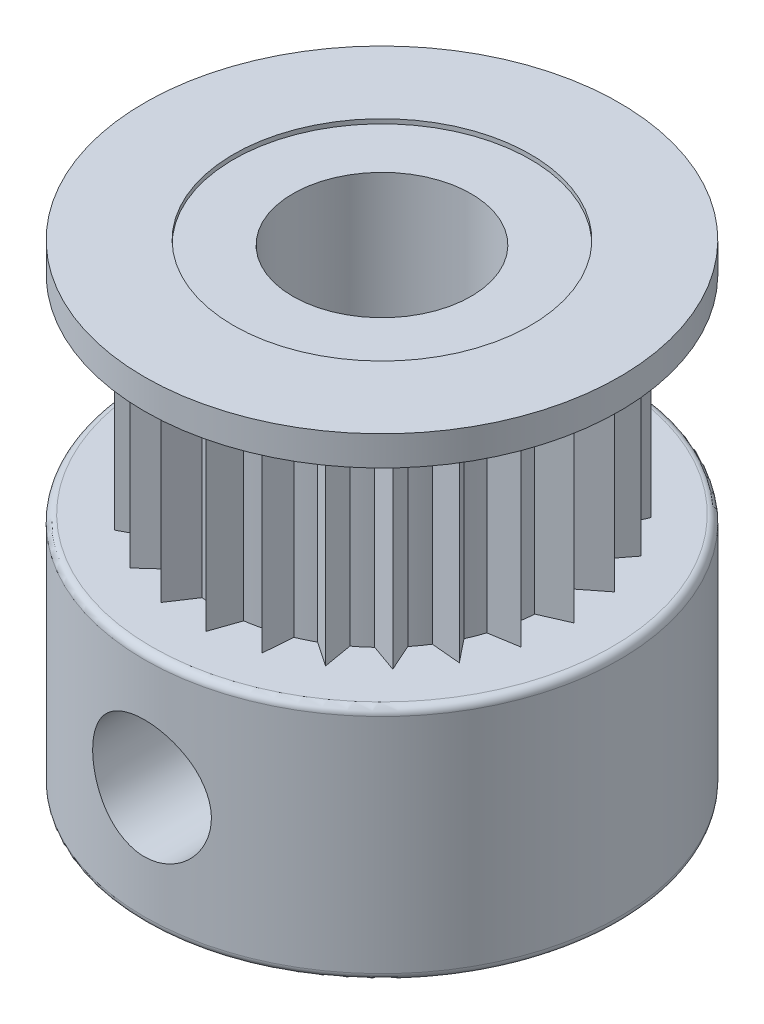
from build123d import *

# Parameters (mm, degrees)
SKETCH1_R           = 8
BOSS_EXTRUDE1_DEPTH = 16
SKETCH3_R           = 5
CUT_EXTRUDE2_DEPTH  = 0.15
CUT_EXTRUDE3_START  = -15.85
SKETCH3_2_R         = 5
CUT_EXTRUDE3_DEPTH  = 0.15
CUT_EXTRUDE6_START  = -8
SKETCH4_OUTSIDE_W   = 23.542
SKETCH4_OUTSIDE_H   = 23.542
SKETCH4_OUTSIDE_R   = 5.5
CUT_EXTRUDE6_DEPTH  = 7
BOSS_EXTRUDE2_START = -1
BOSS_EXTRUDE2_DEPTH = 8
SKETCH2_R           = 3
CUT_EXTRUDE1_DEPTH  = 20.595917942
FILLET1_R           = 0.25
CUT_EXTRUDE7_START  = 2.236067873
CUT_EXTRUDE7_DEPTH  = 6.763932127
CIRPATTERN1_COUNT   = 2
CIRPATTERN1_ANGLE   = 85


with BuildPart() as part:
    # Sketch1 → Boss-Extrude1 (new body)
    with BuildSketch(Plane(origin=(0, 0, 0), x_dir=(1, 0, 0), z_dir=(0, 1, 0))):
        with Locations(Location((0, 0, 0), (0, 0, 270))):
            Circle(SKETCH1_R)
    extrude(amount=BOSS_EXTRUDE1_DEPTH)

    # Sketch3 → Cut-Extrude2 (cut)
    with BuildSketch(Plane(origin=(0, 16, 0), x_dir=(1, 0, 0), z_dir=(0, 1, 0))):
        with Locations(Location((0, 0, 0), (0, 0, 270))):
            Circle(SKETCH3_R)
    extrude(amount=-CUT_EXTRUDE2_DEPTH, mode=Mode.SUBTRACT)

    # Sketch3<2> → Cut-Extrude3 (cut)
    with BuildSketch(Plane(origin=(0, 16, 0), x_dir=(1, 0, 0), z_dir=(0, 1, 0)).offset(CUT_EXTRUDE3_START)):
        with Locations(Location((0, 0, 0), (0, 0, 270))):
            Circle(SKETCH3_2_R)
    extrude(amount=-CUT_EXTRUDE3_DEPTH, mode=Mode.SUBTRACT)

    # Sketch4 outside → Cut-Extrude6 (cut)
    with BuildSketch(Plane(origin=(0, 16, 0), x_dir=(1, 0, 0), z_dir=(0, 1, 0)).offset(CUT_EXTRUDE6_START)):
        Rectangle(SKETCH4_OUTSIDE_W, SKETCH4_OUTSIDE_H)
        with Locations(Location((0, 0, 0), (0, 0, 270))):
            Circle(SKETCH4_OUTSIDE_R, mode=Mode.SUBTRACT)
    extrude(amount=CUT_EXTRUDE6_DEPTH, mode=Mode.SUBTRACT)

    # Sketch5 → Boss-Extrude2 (add)
    with BuildSketch(Plane(origin=(0, 8, 0), x_dir=(1, 0, 0), z_dir=(0, 1, 0)).offset(BOSS_EXTRUDE2_START)):
        with BuildLine():
            ThreePointArc((0.785673383, -5.443594156), (0.393847777, -5.485880415), (0, -5.5))
            Line((0, -5.5), (0.458657655, -6.388613052))
            Line((0.458657655, -6.388613052), (0.785673383, -5.443594156))
        make_face()
        with BuildLine():
            Line((-1.144535378, -6.301966545), (-0.592776807, -5.467962661))
            ThreePointArc((-0.592776807, -5.467962661), (-0.982808657, -5.411477353), (-1.367794379, -5.327207386))
            Line((-1.367794379, -5.327207386), (-1.144535378, -6.301966545))
        make_face()
        with BuildLine():
            ThreePointArc((2.114756826, -5.07718461), (1.745757306, -5.215585435), (1.367794379, -5.327207386))
            Line((1.367794379, -5.327207386), (2.03303154, -6.073839504))
            Line((2.03303154, -6.073839504), (2.114756826, -5.07718461))
        make_face()
        with BuildLine():
            Line((-2.675813043, -5.819344304), (-1.933980651, -5.148758961))
            ThreePointArc((-1.933980651, -5.148758961), (-2.297711608, -4.997051267), (-2.649645208, -4.81968674))
            Line((-2.649645208, -4.81968674), (-2.675813043, -5.819344304))
        make_face()
        with BuildLine():
            ThreePointArc((3.310962319, -4.391756883), (2.987974483, -4.61757604), (2.649645208, -4.81968674))
            Line((2.649645208, -4.81968674), (3.479662577, -5.377424283))
            Line((3.479662577, -5.377424283), (3.310962319, -4.391756883))
        make_face()
        with BuildLine():
            Line((-4.038959534, -4.971071258), (-3.153665377, -4.506039801))
            ThreePointArc((-3.153665377, -4.506039801), (-3.468240889, -4.268642072), (-3.765009083, -4.009327451))
            Line((-3.765009083, -4.009327451), (-4.038959534, -4.971071258))
        make_face()
        with BuildLine():
            ThreePointArc((4.299127873, -3.430378919), (4.042446235, -3.729427361), (3.765009083, -4.009327451))
            Line((3.765009083, -4.009327451), (4.707653617, -4.343125717))
            Line((4.707653617, -4.343125717), (4.299127873, -3.430378919))
        make_face()
        with BuildLine():
            Line((-5.148323344, -3.810447522), (-4.17519371, -3.580189588))
            ThreePointArc((-4.17519371, -3.580189588), (-4.420847839, -3.272018397), (-4.64380359, -2.947047372))
            Line((-4.64380359, -2.947047372), (-5.148323344, -3.810447522))
        make_face()
        with BuildLine():
            ThreePointArc((5.017163412, -2.253457632), (4.842916222, -2.606945044), (4.64380359, -2.947047372))
            Line((4.64380359, -2.947047372), (5.639845466, -3.03593259))
            Line((5.639845466, -3.03593259), (5.017163412, -2.253457632))
        make_face()
        with BuildLine():
            Line((-5.934199063, -2.410399355), (-4.934379267, -2.429382896))
            ThreePointArc((-4.934379267, -2.429382896), (-5.09567666, -2.069801772), (-5.23081084, -1.699593469))
            Line((-5.23081084, -1.699593469), (-5.934199063, -2.410399355))
        make_face()
        with BuildLine():
            ThreePointArc((5.419952122, -0.934943314), (5.339087973, -1.320658783), (5.23081084, -1.699593469))
            Line((5.23081084, -1.699593469), (6.217665083, -1.537980652))
            Line((6.217665083, -1.537980652), (5.419952122, -0.934943314))
        make_face()
        with BuildLine():
            Line((-6.347207231, -0.858896931), (-5.383519626, -1.125929142))
            ThreePointArc((-5.383519626, -1.125929142), (-5.450325377, -0.737531889), (-5.489147006, -0.345347857))
            Line((-5.489147006, -0.345347857), (-6.347207231, -0.858896931))
        make_face()
        with BuildLine():
            ThreePointArc((5.482185306, 0.442316931), (5.49978519, 0.048609327), (5.489147006, -0.345347857))
            Line((5.489147006, -0.345347857), (6.404805936, 0.056608266))
            Line((6.404805936, 0.056608266), (5.482185306, 0.442316931))
        make_face()
        with BuildLine():
            Line((-6.361397025, 0.746573145), (-5.494393649, 0.248270881))
            ThreePointArc((-5.494393649, 0.248270881), (-5.462510105, 0.641079834), (-5.402579879, 1.03059723))
            Line((-5.402579879, 1.03059723), (-6.361397025, 0.746573145))
        make_face()
        with BuildLine():
            Line((-5.975876848, 2.305133285), (-5.260034712, 1.606871132))
            ThreePointArc((-5.260034712, 1.606871132), (-5.131465233, 1.979410154), (-4.976548789, 2.341786104))
            Line((-4.976548789, 2.341786104), (-5.975876848, 2.305133285))
        make_face()
        with BuildLine():
            ThreePointArc((5.199952626, 1.791784777), (5.314910677, 1.414823134), (5.402579879, 1.03059723))
            Line((5.402579879, 1.03059723), (6.189509276, 1.647640279))
            Line((6.189509276, 1.647640279), (5.199952626, 1.791784777))
        make_face()
        with BuildLine():
            Line((-5.214870352, 3.718853423), (-4.695168448, 2.864505759))
            ThreePointArc((-4.695168448, 2.864505759), (-4.477991529, 3.193366854), (-4.237822835, 3.505831944))
            Line((-4.237822835, 3.505831944), (-5.214870352, 3.718853423))
        make_face()
        with BuildLine():
            ThreePointArc((4.590987798, 3.028668195), (4.796080779, 2.6921384), (4.976548789, 2.341786104))
            Line((4.976548789, 2.341786104), (5.585302986, 3.135144993))
            Line((5.585302986, 3.135144993), (4.590987798, 3.028668195))
        make_face()
        with BuildLine():
            Line((-4.126194372, 4.898904324), (-3.835287483, 3.942152955))
            ThreePointArc((-3.835287483, 3.942152955), (-3.543149148, 4.20667257), (-3.232818888, 4.449593469))
            Line((-3.232818888, 4.449593469), (-4.126194372, 4.898904324))
        make_face()
        with BuildLine():
            ThreePointArc((3.693554323, 4.075249252), (3.975895487, 3.800296709), (4.237822835, 3.505831944))
            Line((4.237822835, 3.505831944), (4.630151567, 4.425657017))
            Line((4.630151567, 4.425657017), (3.693554323, 4.075249252))
        make_face()
        with BuildLine():
            Line((-2.778254424, 5.771139049), (-2.734421301, 4.772100182))
            ThreePointArc((-2.734421301, 4.772100182), (-2.385677676, 4.955657578), (-2.02468504, 5.113770672))
            Line((-2.02468504, 5.113770672), (-2.778254424, 5.771139049))
        make_face()
        with BuildLine():
            ThreePointArc((2.564041245, 4.86576741), (2.905890059, 4.6696684), (3.232818888, 4.449593469))
            Line((3.232818888, 4.449593469), (3.384070697, 5.438088735))
            Line((3.384070697, 5.438088735), (2.564041245, 4.86576741))
        make_face()
        with BuildLine():
            Line((-1.255746534, 6.280751883), (-1.461741372, 5.302198804))
            ThreePointArc((-1.461741372, 5.302198804), (-1.078305301, 5.393260394), (-0.689332785, 5.456630857))
            Line((-0.689332785, 5.456630857), (-1.255746534, 6.280751883))
        make_face()
        with BuildLine():
            ThreePointArc((1.273420026, 5.350551508), (1.653296872, 5.245627651), (2.02468504, 5.113770672))
            Line((2.02468504, 5.113770672), (1.925356219, 6.108825337))
            Line((1.925356219, 6.108825337), (1.273420026, 5.350551508))
        make_face()
        with BuildLine():
            Line((0.34566453, 6.395721977), (-0.097214856, 5.499140776))
            ThreePointArc((-0.097214856, 5.499140776), (0.296820962, 5.491984825), (0.689332785, 5.456630857))
            Line((0.689332785, 5.456630857), (0.34566453, 6.395721977))
        make_face()
    extrude(amount=BOSS_EXTRUDE2_DEPTH)

    # Sketch2 → Cut-Extrude1 (cut, through all)
    with BuildSketch(Plane(origin=(0, 16, 0), x_dir=(1, 0, 0), z_dir=(0, 1, 0))):
        with Locations(Location((0, 0, 0), (0, 0, 270))):
            Circle(SKETCH2_R)
    extrude(amount=-CUT_EXTRUDE1_DEPTH, mode=Mode.SUBTRACT)

    # Fillet1
    fillet1_edges = [part.edges().sort_by_distance(p)[0] for p in [
        (0, 8, -8),
        (0, 0, -8),
    ]]
    fillet(fillet1_edges, radius=FILLET1_R)

    # Cut-Extrude7: read off the stored shape, not the designer's step
    # Cut-Extrude7 outline → Cut-Extrude7 (cut)
    with BuildSketch(Plane.XY.offset(CUT_EXTRUDE7_START)):
        with BuildLine():
            add(Edge.make_bspline(
                [(0, 2.000000019), (0.523667809, 2.000015573), (1.043901842, 2.215491418), (1.784755039, 2.956311202), (1.999776413, 3.475862649), (2.000223222, 4.522429637), (1.783898608, 5.043937175), (1.046791416, 5.782225238), (0.528759578, 5.999727047), (-0.5266927, 6.000272419), (-1.04604875, 5.781944053), (-1.780706657, 5.048153803), (-2, 4.530786526), (-2, 4), (-2, 3.469213474), (-1.78144969, 2.952937054), (-1.046648154, 2.218306578), (-0.525333737, 2.000326746), (-0.000830285, 2.000000129), (-0.000415141, 2.000000006), (0, 2.000000019)],
                knots=[0.250099016, 0.250099016, 0.250099016, 0.250099016, 0.375, 0.375, 0.5, 0.5, 0.625, 0.625, 0.75, 0.75, 0.875, 0.875, 1, 1, 1, 1.125, 1.125, 1.25, 1.25, 1.250099016, 1.250099016, 1.250099016, 1.250099016], degree=3))
        make_face()
    cut_extrude7 = extrude(amount=CUT_EXTRUDE7_DEPTH, mode=Mode.SUBTRACT)

    # CirPattern1: Cut-Extrude7 ×2 about axis
    cirpattern1_axis = Axis((0, 16, 0), (0, -1, 0))
    for i in range(1, CIRPATTERN1_COUNT):
        add(cut_extrude7.rotate(cirpattern1_axis, i * CIRPATTERN1_ANGLE / (CIRPATTERN1_COUNT - 1)), mode=Mode.SUBTRACT)


solid = part.part
